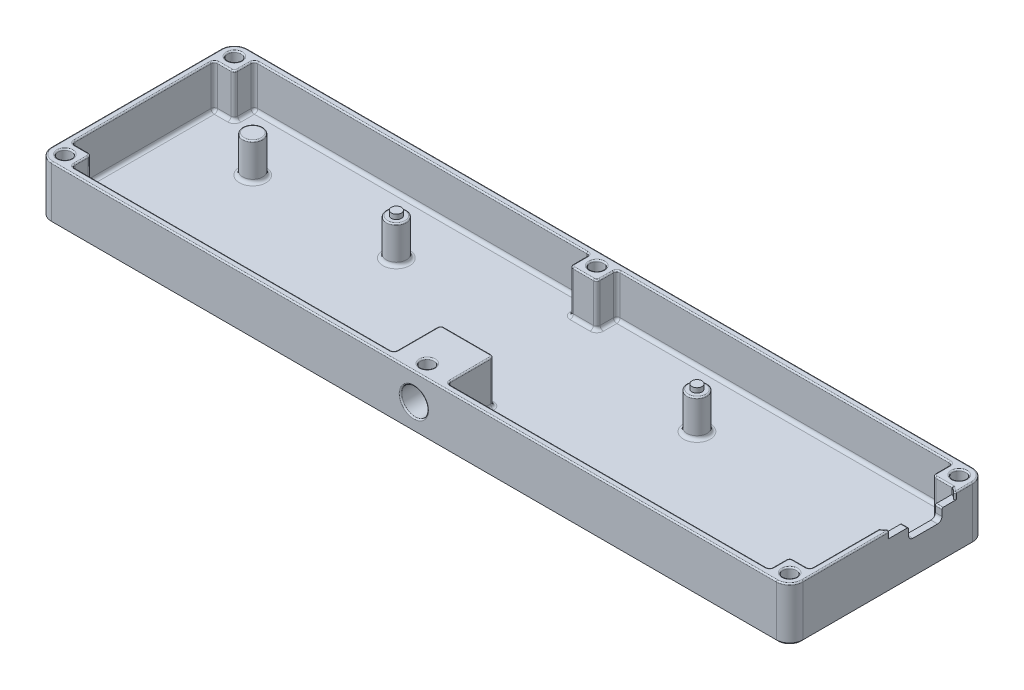
from build123d import *

# Parameters (mm, degrees)
SKETCH1_W           = 8
SKETCH1_H           = 6
SKETCH1_H_2         = 2
SKETCH1_W_2         = 100.5
SKETCH1_W_3         = 6
SKETCH1_W_4         = 2
SKETCH1_H_3         = 42.75
BOSS_EXTRUDE1_DEPTH = 16
SKETCH2_W           = 225
SKETCH2_H           = 58.75
BOSS_EXTRUDE2_DEPTH = 3
FILLET2_R           = 4
CUT_EXTRUDE1_START  = -2
CUT_EXTRUDE1_DEPTH  = 2
SKETCH4_W           = 2
SKETCH4_H           = 10
CUT_EXTRUDE2_DEPTH  = 3.5
BOSS_EXTRUDE3_START = -14
SKETCH6_R           = 3
BOSS_EXTRUDE3_DEPTH = 11
SKETCH7_R           = 1.5
BOSS_EXTRUDE4_DEPTH = 1.4
SKETCH8_W           = 16
SKETCH8_H           = 14
BOSS_EXTRUDE5_DEPTH = 16
SKETCH9_R           = 4
CUT_EXTRUDE4_DEPTH  = 13.7
SKETCH10_R          = 2
CUT_EXTRUDE6_DEPTH  = 4.5
FILLET1_R           = 1.3
FILLET3_R           = 1
FILLET4_R           = 0.4
CHAMFER1_SIZE       = 0.6


# Read off the part's stored shape, not the designer's step: Cut-Extrude1
with BuildPart() as part:
    # Sketch1 → Boss-Extrude1 (new body)
    with BuildSketch(Plane(origin=(0, 0, 0), x_dir=(1, 0, 0), z_dir=(0, 1, 0))):
        with Locations((0, 24.375)):
            Rectangle(SKETCH1_W, SKETCH1_H)
        with Locations((0, 28.375)):
            Rectangle(SKETCH1_W, SKETCH1_H_2)
        with Locations((54.25, 28.375)):
            Rectangle(SKETCH1_W_2, SKETCH1_H_2)
        with Locations((107.5, 24.375)):
            Rectangle(SKETCH1_W_3, SKETCH1_H)
        Polygon((104.5, 29.375), (104.5, 27.375), (110.5, 27.375), (110.5, 21.375), (112.5, 21.375), (112.5, 29.375), align=None)
        with Locations((111.5, 0)):
            Rectangle(SKETCH1_W_4, SKETCH1_H_3)
        with Locations((107.5, -24.375)):
            Rectangle(SKETCH1_W_3, SKETCH1_H)
        Polygon((112.5, -21.375), (110.5, -21.375), (110.5, -27.375), (104.5, -27.375), (104.5, -29.375), (112.5, -29.375), align=None)
        with Locations((54.25, -28.375)):
            Rectangle(SKETCH1_W_2, SKETCH1_H_2)
        with Locations((0, -28.375)):
            Rectangle(SKETCH1_W, SKETCH1_H_2)
        with Locations((0, -24.375)):
            Rectangle(SKETCH1_W, SKETCH1_H)
        with Locations((-54.25, -28.375)):
            Rectangle(SKETCH1_W_2, SKETCH1_H_2)
        Polygon((-110.5, -27.375), (-110.5, -21.375), (-112.5, -21.375), (-112.5, -29.375), (-104.5, -29.375), (-104.5, -27.375), align=None)
        with Locations((-107.5, -24.375)):
            Rectangle(SKETCH1_W_3, SKETCH1_H)
        with Locations((-111.5, 0)):
            Rectangle(SKETCH1_W_4, SKETCH1_H_3)
        Polygon((-110.5, 21.375), (-110.5, 27.375), (-104.5, 27.375), (-104.5, 29.375), (-112.5, 29.375), (-112.5, 21.375), align=None)
        with Locations((-107.5, 24.375)):
            Rectangle(SKETCH1_W_3, SKETCH1_H)
        with Locations((-54.25, 28.375)):
            Rectangle(SKETCH1_W_2, SKETCH1_H_2)
    extrude(amount=BOSS_EXTRUDE1_DEPTH)

    # Sketch2 → Boss-Extrude2 (add)
    with BuildSketch(Plane.XZ):
        Rectangle(SKETCH2_W, SKETCH2_H)
    extrude(amount=-BOSS_EXTRUDE2_DEPTH)

    # Fillet2
    fillet2_edges = [part.edges().sort_by_distance(p)[0] for p in [
        (-112.5, 8, 29.375),
        (-112.5, 8, -29.375),
        (112.5, 8, -29.375),
        (112.5, 8, 29.375),
    ]]
    fillet(fillet2_edges, radius=FILLET2_R)

    # Cut-Extrude1 outline → Cut-Extrude1 (cut)
    with BuildSketch(Plane(origin=(0, 16, 0), x_dir=(1, 0, 0), z_dir=(0, 1, 0)).offset(CUT_EXTRUDE1_START)):
        with BuildLine():
            Line((110.5, 21.29162479), (110.5, -0.54162479))
            ThreePointArc((110.5, -0.54162479), (111.726377413, 0.312858313), (112.5, 1.591784043))
            Line((112.5, 1.591784043), (112.5, 19.158215957))
            ThreePointArc((112.5, 19.158215957), (111.726377413, 20.437141687), (110.5, 21.29162479))
        make_face()
    extrude(amount=CUT_EXTRUDE1_DEPTH, mode=Mode.SUBTRACT)

    # Sketch4 → Cut-Extrude2 (cut)
    with BuildSketch(Plane(origin=(0, 14, 0), x_dir=(1, 0, 0), z_dir=(0, 1, 0))):
        with Locations((111.5, 11.231784043)):
            Rectangle(SKETCH4_W, SKETCH4_H)
    extrude(amount=-CUT_EXTRUDE2_DEPTH, mode=Mode.SUBTRACT)

    # Sketch6 → Boss-Extrude3 (add)
    with BuildSketch(Plane(origin=(0, 0, 0), x_dir=(-1, 0, 0), z_dir=(0, -1, 0)).offset(BOSS_EXTRUDE3_START)):
        with Locations(Location((-45, 10.375, 0), (0, 0, 270))):
            Circle(SKETCH6_R)
        with Locations(Location((45, 10.375, 0), (0, 0, 270))):
            Circle(SKETCH6_R)
        with Locations(Location((88, 10.375, 0), (0, 0, 270))):
            Circle(SKETCH6_R)
    extrude(amount=BOSS_EXTRUDE3_DEPTH)

    # Sketch7 → Boss-Extrude4 (add)
    with BuildSketch(Plane(origin=(0, 14, 0), x_dir=(1, 0, 0), z_dir=(0, 1, 0))):
        with Locations(Location((45, 10.375, 0), (0, 0, 270))):
            Circle(SKETCH7_R)
        with Locations(Location((-45, 10.375, 0), (0, 0, 270))):
            Circle(SKETCH7_R)
    extrude(amount=BOSS_EXTRUDE4_DEPTH)

    # Sketch8 → Boss-Extrude5 (add)
    with BuildSketch(Plane(origin=(0, 0, 0), x_dir=(-1, 0, 0), z_dir=(0, -1, 0))):
        with Locations((0, -20.375)):
            Rectangle(SKETCH8_W, SKETCH8_H)
    extrude(amount=-BOSS_EXTRUDE5_DEPTH)

    # Sketch9 → Cut-Extrude4 (cut)
    with BuildSketch(Plane.XY.offset(29.375)):
        with Locations((0, 8)):
            Circle(SKETCH9_R)
    extrude(amount=-CUT_EXTRUDE4_DEPTH, mode=Mode.SUBTRACT)

    # Sketch10 → Cut-Extrude6 (cut)
    with BuildSketch(Plane(origin=(0, 16, 0), x_dir=(1, 0, 0), z_dir=(0, 1, 0))):
        with Locations(Location((-108.5, -25.375, 0), (0, 0, 270))):
            Circle(SKETCH10_R)
        with Locations(Location((-108.5, 25.375, 0), (0, 0, 270))):
            Circle(SKETCH10_R)
        with Locations(Location((0, 25.375, 0), (0, 0, 270))):
            Circle(SKETCH10_R)
        with Locations(Location((108.5, 25.375, 0), (0, 0, 270))):
            Circle(SKETCH10_R)
        with Locations(Location((108.5, -25.375, 0), (0, 0, 270))):
            Circle(SKETCH10_R)
        with Locations(Location((0, -25.375, 0), (0, 0, 270))):
            Circle(SKETCH10_R)
    extrude(amount=-CUT_EXTRUDE6_DEPTH, mode=Mode.SUBTRACT)

    # Fillet1
    fillet1_edges = [part.edges().sort_by_distance(p)[0] for p in [
        (111.5, 10.5, -16.231784043),
        (111.5, 10.5, -6.231784043),
    ]]
    fillet(fillet1_edges, radius=FILLET1_R)

    # Fillet3
    fillet3_edges = [part.edges().sort_by_distance(p)[0] for p in [
        (-104.5, 3, 24.375),
        (-110.5, 3, 0),
        (-107.5, 3, -21.375),
        (-54.25, 3, -27.375),
        (-4, 3, -24.375),
        (0, 3, -21.375),
        (54.25, 3, -27.375),
        (104.5, 3, 24.375),
        (107.5, 3, 21.375),
        (110.5, 3, 0),
        (107.5, 3, -21.375),
        (104.5, 3, -24.375),
        (4, 3, -24.375),
        (-104.5, 3, -24.375),
        (-107.5, 3, 21.375),
        (-56.25, 3, 27.375),
        (-45, 3, -13.375),
        (45, 3, -13.375),
        (-88, 3, -13.375),
        (56.25, 3, 27.375),
        (-8, 3, 20.375),
        (0, 3, 13.375),
        (8, 3, 20.375),
        (8, 9.5, 13.375),
        (8, 9.5, 27.375),
        (-8, 9.5, 27.375),
        (-8, 9.5, 13.375),
        (104.5, 9.5, 27.375),
        (104.5, 9.5, 21.375),
        (110.5, 9.5, 21.375),
        (104.5, 9.5, -21.375),
        (104.5, 9.5, -27.375),
        (4, 9.5, -27.375),
        (4, 9.5, -21.375),
        (-4, 9.5, -21.375),
        (-4, 9.5, -27.375),
        (-104.5, 9.5, -27.375),
        (-104.5, 9.5, -21.375),
        (-110.5, 9.5, -21.375),
        (-110.5, 9.5, 21.375),
        (-104.5, 9.5, 21.375),
        (-104.5, 9.5, 27.375),
    ]]
    fillet(fillet3_edges, radius=FILLET3_R)

    # Fillet4
    fillet4_edges = [part.edges().sort_by_distance(p)[0] for p in [
        (112.5, 16, 11.891607978),
        (0, 16, 29.375),
        (0, 16, -29.375),
        (-112.5, 16, 0),
        (-111.328427125, 16, -28.203427125),
        (111.328427125, 16, -28.203427125),
        (-111.328427125, 16, 28.203427125),
        (111.328427125, 16, 28.203427125),
        (110.5, 16, -21.333312395),
        (112.5, 16, -22.266607979),
        (112.5, 15, -19.158215957),
        (112.5, 15, -1.591784043),
        (111.726377413, 16, -20.437141687),
        (111.726377413, 16, -0.312858313),
        (111.5, 14, -6.231784043),
        (111.5, 14, -16.231784043),
        (-45, 14, -13.375),
        (45, 14, -13.375),
        (-88, 14, -13.375),
        (-4, 8, 29.375),
        (-108.5, 16, -27.375),
        (0, 16, -27.375),
        (108.5, 16, -27.375),
        (108.5, 16, 23.375),
        (0, 16, 23.375),
        (-108.5, 16, 23.375),
        (0, 16, 13.375),
        (-8, 16, 20.375),
        (-56.25, 16, 27.375),
        (-104.5, 16, 24.375),
        (-107.5, 16, 21.375),
        (-110.5, 16, 0),
        (-107.5, 16, -21.375),
        (-104.5, 16, -24.375),
        (-54.25, 16, -27.375),
        (-4, 16, -24.375),
        (0, 16, -21.375),
        (4, 16, -24.375),
        (54.25, 16, -27.375),
        (104.5, 16, -24.375),
        (110.5, 16, 10.458312395),
        (107.5, 16, 21.375),
        (104.5, 16, 24.375),
        (56.25, 16, 27.375),
        (8, 16, 20.375),
        (7.707106781, 16, 13.667893219),
        (-104.792893219, 16, 21.667893219),
        (-104.792893219, 16, -21.667893219),
        (-3.707106781, 16, -21.667893219),
        (3.707106781, 16, -21.667893219),
        (104.792893219, 16, -21.667893219),
        (104.792893219, 16, 21.667893219),
        (-7.707106781, 16, 13.667893219),
        (8.292893219, 16, 27.082106781),
        (104.207106781, 16, 27.082106781),
        (110.207106781, 16, 21.082106781),
        (104.207106781, 16, -27.082106781),
        (4.292893219, 16, -27.082106781),
        (-4.292893219, 16, -27.082106781),
        (-104.207106781, 16, -27.082106781),
        (-110.207106781, 16, -21.082106781),
        (-110.207106781, 16, 21.082106781),
        (-104.207106781, 16, 27.082106781),
        (-8.292893219, 16, 27.082106781),
        (108, 16, -21.375),
    ]]
    fillet(fillet4_edges, radius=FILLET4_R)

    # Chamfer1
    chamfer1_edges = [part.edges().sort_by_distance(p)[0] for p in [
        (112.5, 0, 0),
        (0, 0, 29.375),
        (-112.5, 0, 0),
        (0, 0, -29.375),
        (-111.328427125, 0, -28.203427125),
        (111.328427125, 0, -28.203427125),
        (-111.328427125, 0, 28.203427125),
        (111.328427125, 0, 28.203427125),
    ]]
    chamfer(chamfer1_edges, length=CHAMFER1_SIZE)


solid = part.part
